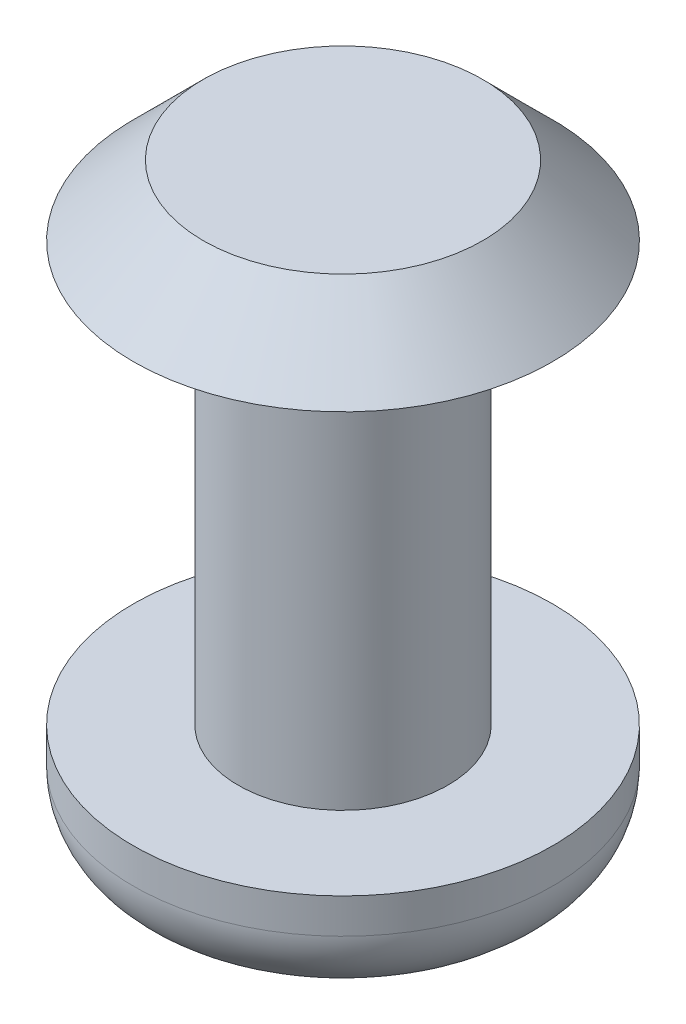
from build123d import *

# Parameters (mm, degrees)
ESQUISSE1_W             = 1.5
ESQUISSE1_H             = 6
ESQUISSE2_R             = 3
BOSS_EXTRU_1_DEPTH      = 1
CHANFREIN1_SIZE         = 1
BOSS_EXTRU_2_START      = 1.5
ESQUISSE3_R             = 3
BOSS_EXTRU_2_DEPTH      = 1.5
CONG_1_R                = 1
ESQUISSE4_R             = 1.25
ENL_V_MAT_EXTRU_1_DEPTH = 8


with BuildPart() as part:
    # Esquisse1 → Révol.-Mince1 (revolve)
    with BuildSketch(Plane.XY, mode=Mode.PRIVATE) as r_vol_mince1_sk:
        with Locations((-0.75, 3)):
            Rectangle(ESQUISSE1_W, ESQUISSE1_H)
    revolve(r_vol_mince1_sk.sketch.rotate(Axis((0, 0, 0), (0, 1, 0)), 270), axis=Axis((0, 0, 0), (0, 1, 0)))

    # Esquisse2 → Boss.-Extru.1 (add)
    with BuildSketch(Plane(origin=(0, 6, 0), x_dir=(1, 0, 0), z_dir=(0, 1, 0))):
        with Locations(Location((0, 0, 0), (0, 0, 270))):
            Circle(ESQUISSE2_R)
    extrude(amount=BOSS_EXTRU_1_DEPTH)

    # Chanfrein1
    chanfrein1_edges = [part.edges().sort_by_distance(p)[0] for p in [
        (0, 7, -3),
    ]]
    chamfer(chanfrein1_edges, length=CHANFREIN1_SIZE - 0.0001)  # a hair under: the kernel refuses the full size

    # Esquisse3 → Boss.-Extru.2 (add)
    with BuildSketch(Plane.XZ.offset(BOSS_EXTRU_2_START)):
        with Locations(Location((0, 0, 0), (0, 0, 270))):
            Circle(ESQUISSE3_R)
    extrude(amount=-BOSS_EXTRU_2_DEPTH)

    # Congé1
    cong_1_edges = [part.edges().sort_by_distance(p)[0] for p in [
        (0, -1.5, 3),
    ]]
    fillet(cong_1_edges, radius=CONG_1_R)

    # Esquisse4 → Enlèv. mat.-Extru.1 (cut)
    with BuildSketch(Plane(origin=(0, -1.5, 0), x_dir=(-1, 0, 0), z_dir=(0, -1, 0))):
        with Locations(Location((0, 0, 0), (0, 0, 90))):
            Circle(ESQUISSE4_R)
    extrude(amount=-ENL_V_MAT_EXTRU_1_DEPTH, mode=Mode.SUBTRACT)


solid = part.part
